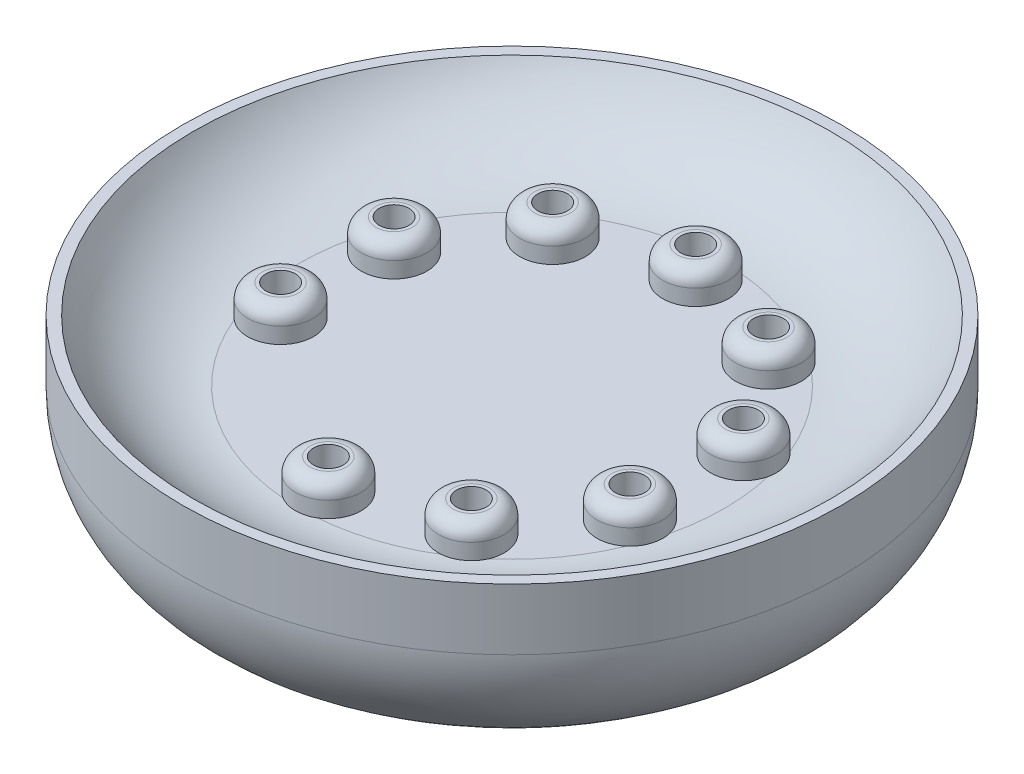
from build123d import *

# Parameters (mm, degrees)
ESBO_O1_R                  = 10.765
RESSALTO_EXTRUS_O1_DEPTH   = 6
FILETE2_R                  = 4
ESBO_O5_R                  = 10.405
CORTE_EXTRUS_O2_DEPTH      = 2
FILETE3_R                  = 4
CORTE_EXTRUS_O4_DEPTH      = 14
CORTE_EXTRUS_O4_DEPTH_BACK = 10
ESBO_O6_R                  = 0.485
RESSALTO_EXTRUS_O2_START   = 1
ESBO_O7_R                  = 1.074632639
ESBO_O7_R_2                = 0.485
RESSALTO_EXTRUS_O2_DEPTH   = 1
FILETE5_R                  = 0.48


with BuildPart() as part:
    # Esboço1 → Ressalto-extrusão1 (new body)
    with BuildSketch(Plane(origin=(0, 0, 0), x_dir=(1, 0, 0), z_dir=(0, 1, 0))):
        with Locations(Location((0, 0, 0), (0, 0, 270))):
            Circle(ESBO_O1_R)
    extrude(amount=RESSALTO_EXTRUS_O1_DEPTH)

    # Filete2
    filete2_edges = [part.edges().sort_by_distance(p)[0] for p in [
        (0, 0, -10.765),
    ]]
    fillet(filete2_edges, radius=FILETE2_R)

    # Esboço5 → Corte-extrusão2 (cut)
    with BuildSketch(Plane(origin=(0, 6, 0), x_dir=(1, 0, 0), z_dir=(0, 1, 0))):
        with Locations(Location((0, 0, 0), (0, 0, 270))):
            Circle(ESBO_O5_R)
    extrude(amount=-CORTE_EXTRUS_O2_DEPTH, mode=Mode.SUBTRACT)

    # Filete3
    # the kernel refuses this fillet: 4 mm, written as the material it adds along each edge
    with BuildSketch(Plane(origin=(0, 4, 0), x_dir=(0, 0, 1), z_dir=(-1, 0, 0))) as filete3_piece_1:
        with BuildLine():
            CenterArc((6.940898385, 4), FILETE3_R, 270, 60)
            Line((6.940898385, 0), (6.940898385, -0.08))
            Line((6.940898385, -0.08), (10.405, -0.08))
            Line((10.405, -0.08), (10.485, 0))
            ThreePointArc((10.485, 0), (10.485, 1), (10.474282032, 1.96))
            Line((10.474282032, 1.96), (10.405, 2))
        make_face()
    revolve(axis=Axis((0, 4, 0), (0, 1, 0)))

    # Esboço6 → Corte-extrusão4 (cut, two sides: drawn at the far end of the back side and taken through both)
    with BuildSketch(Plane(origin=(0, 4, 0), x_dir=(1, 0, 0), z_dir=(0, 1, 0)).offset(-CORTE_EXTRUS_O4_DEPTH_BACK)):
        with Locations(Location((0, 6, 0), (0, 0, 270))):
            Circle(ESBO_O6_R)
        with Locations(Location((3.526711514, 4.854101966, 0), (0, 0, 270))):
            Circle(ESBO_O6_R)
        with Locations(Location((5.706339098, 1.854101966, 0), (0, 0, 270))):
            Circle(ESBO_O6_R)
        with Locations(Location((5.706339098, -1.854101966, 0), (0, 0, 270))):
            Circle(ESBO_O6_R)
        with Locations(Location((3.526711514, -4.854101966, 0), (0, 0, 270))):
            Circle(ESBO_O6_R)
        with Locations(Location((0, -6, 0), (0, 0, 270))):
            Circle(ESBO_O6_R)
        with Locations(Location((-5.706339098, -1.854101966, 0), (0, 0, 270))):
            Circle(ESBO_O6_R)
        with Locations(Location((-5.706339098, 1.854101966, 0), (0, 0, 270))):
            Circle(ESBO_O6_R)
        with Locations(Location((-3.526711514, 4.854101966, 0), (0, 0, 270))):
            Circle(ESBO_O6_R)
    extrude(amount=CORTE_EXTRUS_O4_DEPTH + CORTE_EXTRUS_O4_DEPTH_BACK, mode=Mode.SUBTRACT)

    # Esboço7 → Ressalto-extrusão2 (add)
    # profile 1 of 9: a face of its own
    with BuildSketch(Plane(origin=(0, 4, 0), x_dir=(1, 0, 0), z_dir=(0, 1, 0)).offset(RESSALTO_EXTRUS_O2_START)):
        with Locations(Location((-3.526711514, 4.854101966, 0), (0, 0, 94.72124094))):
            Circle(ESBO_O7_R)
        with Locations(Location((-3.526711514, 4.854101966, 0), (0, 0, 270))):
            Circle(ESBO_O7_R_2, mode=Mode.SUBTRACT)
    # profile 2 of 9: a face of its own
    with BuildSketch(Plane(origin=(0, 4, 0), x_dir=(1, 0, 0), z_dir=(0, 1, 0)).offset(RESSALTO_EXTRUS_O2_START)):
        with Locations(Location((0, 6, 0), (0, 0, 121.27875906))):
            Circle(ESBO_O7_R)
        with Locations(Location((0, 6, 0), (0, 0, 270.000000001))):
            Circle(ESBO_O7_R_2, mode=Mode.SUBTRACT)
    # profile 3 of 9: a face of its own
    with BuildSketch(Plane(origin=(0, 4, 0), x_dir=(1, 0, 0), z_dir=(0, 1, 0)).offset(RESSALTO_EXTRUS_O2_START)):
        with Locations(Location((3.526711514, 4.854101966, 0), (0, 0, 85.27875906))):
            Circle(ESBO_O7_R)
        with Locations(Location((3.526711514, 4.854101966, 0), (0, 0, 270.000000002))):
            Circle(ESBO_O7_R_2, mode=Mode.SUBTRACT)
    # profile 4 of 9: a face of its own
    with BuildSketch(Plane(origin=(0, 4, 0), x_dir=(1, 0, 0), z_dir=(0, 1, 0)).offset(RESSALTO_EXTRUS_O2_START)):
        with Locations(Location((5.706339098, 1.854101966, 0), (0, 0, 49.27875906))):
            Circle(ESBO_O7_R)
        with Locations(Location((5.706339098, 1.854101966, 0), (0, 0, 270.000000003))):
            Circle(ESBO_O7_R_2, mode=Mode.SUBTRACT)
    # profile 5 of 9: a face of its own
    with BuildSketch(Plane(origin=(0, 4, 0), x_dir=(1, 0, 0), z_dir=(0, 1, 0)).offset(RESSALTO_EXTRUS_O2_START)):
        with Locations(Location((5.706339098, -1.854101966, 0), (0, 0, 13.27875906))):
            Circle(ESBO_O7_R)
        with Locations(Location((5.706339098, -1.854101966, 0), (0, 0, 270.000000004))):
            Circle(ESBO_O7_R_2, mode=Mode.SUBTRACT)
    # profile 6 of 9: a face of its own
    with BuildSketch(Plane(origin=(0, 4, 0), x_dir=(1, 0, 0), z_dir=(0, 1, 0)).offset(RESSALTO_EXTRUS_O2_START)):
        with Locations(Location((3.526711514, -4.854101966, 0), (0, 0, 337.27875906))):
            Circle(ESBO_O7_R)
        with Locations(Location((3.526711514, -4.854101966, 0), (0, 0, 270.000000004))):
            Circle(ESBO_O7_R_2, mode=Mode.SUBTRACT)
    # profile 7 of 9: a face of its own
    with BuildSketch(Plane(origin=(0, 4, 0), x_dir=(1, 0, 0), z_dir=(0, 1, 0)).offset(RESSALTO_EXTRUS_O2_START)):
        with Locations(Location((0, -6, 0), (0, 0, 301.27875906))):
            Circle(ESBO_O7_R)
        with Locations(Location((0, -6, 0), (0, 0, 270.000000003))):
            Circle(ESBO_O7_R_2, mode=Mode.SUBTRACT)
    # profile 8 of 9: a face of its own
    with BuildSketch(Plane(origin=(0, 4, 0), x_dir=(1, 0, 0), z_dir=(0, 1, 0)).offset(RESSALTO_EXTRUS_O2_START)):
        with Locations(Location((-5.706339098, -1.854101966, 0), (0, 0, 166.72124094))):
            Circle(ESBO_O7_R)
        with Locations(Location((-5.706339098, -1.854101966, 0), (0, 0, 270.000000001))):
            Circle(ESBO_O7_R_2, mode=Mode.SUBTRACT)
    # profile 9 of 9: a face of its own
    with BuildSketch(Plane(origin=(0, 4, 0), x_dir=(1, 0, 0), z_dir=(0, 1, 0)).offset(RESSALTO_EXTRUS_O2_START)):
        with Locations(Location((-5.706339098, 1.854101966, 0), (0, 0, 130.72124094))):
            Circle(ESBO_O7_R)
        with Locations(Location((-5.706339098, 1.854101966, 0), (0, 0, 270))):
            Circle(ESBO_O7_R_2, mode=Mode.SUBTRACT)
    extrude(amount=-RESSALTO_EXTRUS_O2_DEPTH)

    # Filete5
    filete5_edges = [part.edges().sort_by_distance(p)[0] for p in [
        (4.66043774, 5, 2.100933198),
        (2.535475783, 5, 4.439027234),
        (-0.557951746, 5, 5.081563743),
        (-4.66043774, 5, 2.100933198),
        (-5.005270882, 5, -1.039645911),
        (-3.438260671, 5, -3.783115619),
        (0.557951746, 5, -5.081563743),
        (3.438260671, 5, -3.783115619),
        (5.005270882, 5, -1.039645911),
    ]]
    fillet(filete5_edges, radius=FILETE5_R)


solid = part.part
